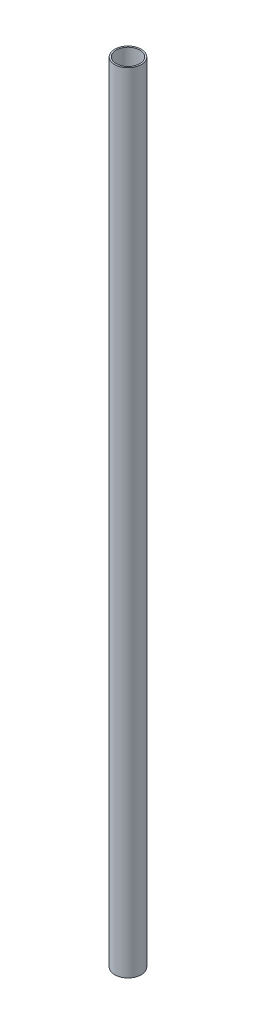
from build123d import *

# Parameters (mm, degrees)
SKETCH1_R           = 6.858
SKETCH1_R_2         = 6.096
BOSS_EXTRUDE1_DEPTH = 406.4


with BuildPart() as part:
    # Sketch1 → Boss-Extrude1 (new body)
    with BuildSketch(Plane(origin=(0, 0, 0), x_dir=(1, 0, 0), z_dir=(0, 1, 0))):
        Circle(SKETCH1_R)
        Circle(SKETCH1_R_2, mode=Mode.SUBTRACT)
    extrude(amount=BOSS_EXTRUDE1_DEPTH)


solid = part.part
